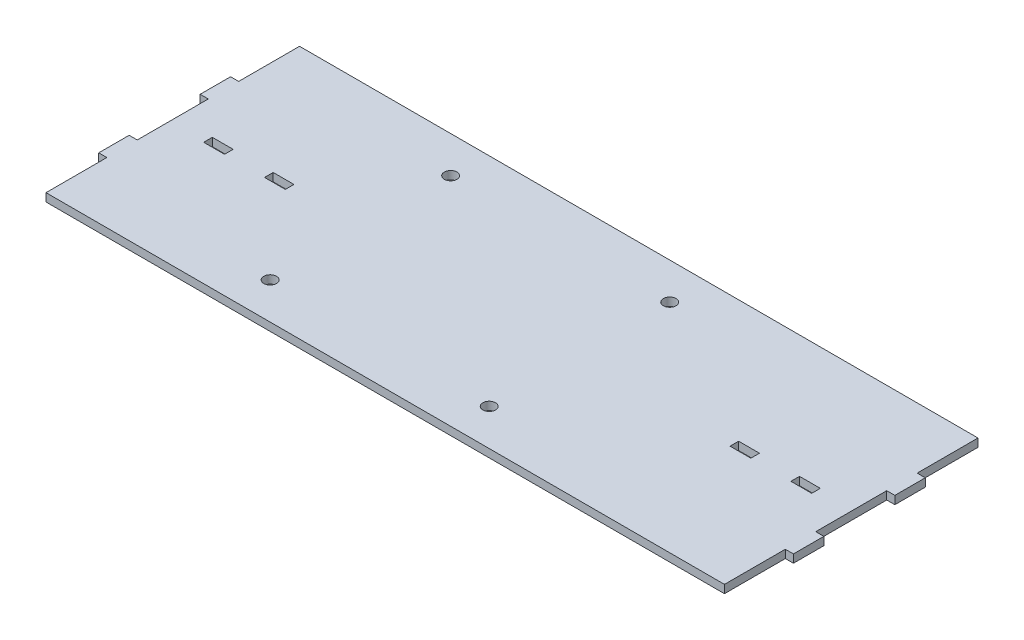
from build123d import *

# Parameters (mm, degrees)
SKETCH1_W                        = 685
SKETCH1_H                        = 250
BASE_FLANGE1_DEPTH               = 8
SKETCH6_W                        = 60
SKETCH6_H                        = 8
SKETCH6_W_2                      = 70
EXTRUDE1_DEPTH                   = 8
SKETCH7_W                        = 250
SKETCH7_H                        = 73.5
BASE_FLANGE2_DEPTH               = 8
SKETCH12_W                       = 30.5
SKETCH12_H                       = 8.5
EXTRUDE2_DEPTH                   = 699.681794525
SKETCH14_W                       = 250
SKETCH14_H                       = 8
BASE_FLANGE3_DEPTH               = 50.5
SKETCH19_W                       = 60
SKETCH19_H                       = 8
SKETCH19_W_2                     = 70
EXTRUDE3_DEPTH                   = 8
BREAK_CORNER1_START              = 41.5
BREAK_CORNER1_DEPTH              = 8
EXTRUDE4_DEPTH                   = 8
BASE_FLANGE4_DEPTH               = 8
SKETCH38_W                       = 8.5
SKETCH38_H                       = 20.5
EXTRUDE5_DEPTH                   = 10
SKETCH39_W                       = 20.5
SKETCH39_H                       = 8.5
EXTRUDE6_DEPTH                   = 10
F_12_5_12_5_DIAMETER_HOLE1_D     = 12.5
F_12_5_12_5_DIAMETER_HOLE1_DEPTH = 10
F_12_5_12_5_DIAMETER_HOLE1_TIP   = 3.755378869


# Read off the part's stored shape, not the designer's step: Break-Corner1
# Sheet-metal steps are written as plain solids
with BuildPart() as part:
    # Sketch1 → Base-Flange1 (new body)
    with BuildSketch(Plane(origin=(0, 0, 0), x_dir=(1, 0, 0), z_dir=(0, 1, 0))):
        Rectangle(SKETCH1_W, SKETCH1_H)
    extrude(amount=-BASE_FLANGE1_DEPTH)

    # Sketch6 → Extrude1 (cut)
    with BuildSketch(Plane(origin=(342.5, 0, 0), x_dir=(0, 0, -1), z_dir=(1, 0, 0))):
        with Locations((-95, -4)):
            Rectangle(SKETCH6_W, SKETCH6_H)
        with Locations((95, -4)):
            Rectangle(SKETCH6_W, SKETCH6_H)
        with Locations((0, -4)):
            Rectangle(SKETCH6_W_2, SKETCH6_H)
    extrude1 = extrude(amount=-EXTRUDE1_DEPTH, mode=Mode.SUBTRACT)

    # Mirror1: Extrude1 across plane
    add(extrude1.mirror(Plane(origin=(0, 0, 0), x_dir=(0, 0, 1), z_dir=(1, 0, 0))), mode=Mode.SUBTRACT)

    # Sketch39 → Extrude6 (cut)
    with BuildSketch(Plane.XZ.offset(8)):
        with Locations((289.5, 0)):
            Rectangle(SKETCH39_W, SKETCH39_H)
        with Locations((229.5, 0)):
            Rectangle(SKETCH39_W, SKETCH39_H)
        with Locations((-289.5, 0)):
            Rectangle(SKETCH39_W, SKETCH39_H)
        with Locations((-229.5, 0)):
            Rectangle(SKETCH39_W, SKETCH39_H)
    extrude(amount=-EXTRUDE6_DEPTH, mode=Mode.SUBTRACT)

    # Ø12.5 (12.5) Diameter Hole1
    with Locations(Plane(origin=(131.975, 0, 2029.150100001), x_dir=(1, 0, 0), z_dir=(0, 1, 0))):
        with Locations((-281.475, 2118.150100001), (-281.475, 1940.150100001), (-65.475, 1940.150100001), (-65.475, 2118.150100001)):
            Hole(F_12_5_12_5_DIAMETER_HOLE1_D / 2, depth=F_12_5_12_5_DIAMETER_HOLE1_DEPTH)
            with Locations((0, 0, -(F_12_5_12_5_DIAMETER_HOLE1_DEPTH + F_12_5_12_5_DIAMETER_HOLE1_TIP / 2))):  # 118° drill point
                Cone(0, F_12_5_12_5_DIAMETER_HOLE1_D / 2, F_12_5_12_5_DIAMETER_HOLE1_TIP, mode=Mode.SUBTRACT)


with BuildPart() as body_2:
    # Sketch7 → Base-Flange2 (new body)
    with BuildSketch(Plane(origin=(334.5, 0, 0), x_dir=(0, 0, -1), z_dir=(1, 0, 0))):
        with Locations((0, 20.75)):
            Rectangle(SKETCH7_W, SKETCH7_H)
    extrude(amount=BASE_FLANGE2_DEPTH)

    # Sketch12 → Extrude2 (cut, through all)
    with BuildSketch(Plane(origin=(342.5, 0, 0), x_dir=(0, 0, -1), z_dir=(1, 0, 0))):
        with Locations((-50, -4)):
            Rectangle(SKETCH12_W, SKETCH12_H)
        with Locations((50, -4)):
            Rectangle(SKETCH12_W, SKETCH12_H)
        with Locations((50, 45.5)):
            Rectangle(SKETCH12_W, SKETCH12_H)
        with Locations((-50, 45.5)):
            Rectangle(SKETCH12_W, SKETCH12_H)
    extrude(amount=-EXTRUDE2_DEPTH, mode=Mode.SUBTRACT)

    # Sketch38 → Extrude5 (cut)
    with BuildSketch(Plane(origin=(342.5, 0, 0), x_dir=(0, 0, -1), z_dir=(1, 0, 0))):
        with Locations((0, 27.5)):
            Rectangle(SKETCH38_W, SKETCH38_H)
    extrude(amount=-EXTRUDE5_DEPTH, mode=Mode.SUBTRACT)


with BuildPart() as body_3:
    # Sketch14 → Base-Flange3 (new body)
    with BuildSketch(Plane.ZY.offset(-334.5)):
        with Locations((0, 45.5)):
            Rectangle(SKETCH14_W, SKETCH14_H)
    extrude(amount=-BASE_FLANGE3_DEPTH)

    # Sketch19 → Extrude3 (cut)
    with BuildSketch(Plane(origin=(342.5, 0, 0), x_dir=(0, 0, -1), z_dir=(1, 0, 0))):
        with Locations((95, 45.5)):
            Rectangle(SKETCH19_W, SKETCH19_H)
        with Locations((0, 45.5)):
            Rectangle(SKETCH19_W_2, SKETCH19_H)
        with Locations((-95, 45.5)):
            Rectangle(SKETCH19_W, SKETCH19_H)
    extrude(amount=-EXTRUDE3_DEPTH, mode=Mode.SUBTRACT)

    # Break-Corner1 outline → Break-Corner1 (cut)
    with BuildSketch(Plane(origin=(0, 0, 0), x_dir=(1, 0, 0), z_dir=(0, 1, 0)).offset(BREAK_CORNER1_START)):
        Polygon((385, -125), (385, -110), (370, -125), align=None)
        Polygon((370, 125), (385, 110), (385, 125), align=None)
    extrude(amount=BREAK_CORNER1_DEPTH, mode=Mode.SUBTRACT)

    # Sketch20 → Extrude4 (cut)
    with BuildSketch(Plane(origin=(0, 49.5, 0), x_dir=(1, 0, 0), z_dir=(0, 1, 0))):
        with BuildLine():
            Line((367, 75), (367, 55))
            ThreePointArc((367, 55), (362.5, 50.5), (358, 55))
            Line((358, 55), (358, 75))
            ThreePointArc((358, 75), (362.5, 79.5), (367, 75))
        make_face()
        with BuildLine():
            Line((367, -75), (367, -55))
            ThreePointArc((367, -55), (362.5, -50.5), (358, -55))
            Line((358, -55), (358, -75))
            ThreePointArc((358, -75), (362.5, -79.5), (367, -75))
        make_face()
    extrude(amount=-EXTRUDE4_DEPTH, mode=Mode.SUBTRACT)


with BuildPart() as body_4:
    # Mirror4: mirrored copy
    add(body_3.part.mirror(Plane(origin=(0, 0, 0), x_dir=(0, 0, 1), z_dir=(1, 0, 0))))


with BuildPart() as body_5:
    # Sketch29 → Base-Flange4 (new body)
    with BuildSketch(Plane.XY.offset(4)):
        Polygon((219.5, 0), (219.5, -8), (239.5, -8), (239.5, 0), (279.5, 0), (279.5, -8), (299.5, -8), (299.5, 0), (334.5, 0), (334.5, 17.5), (342.5, 17.5), (342.5, 37.5), (334.5, 37.5), (334.5, 57.5), (194.5, 10), (194.5, 0), align=None)
    extrude(amount=-BASE_FLANGE4_DEPTH)


with BuildPart() as body_6:
    # Mirror5: mirrored copy
    add(body_5.part.mirror(Plane(origin=(0, 0, 0), x_dir=(0, 0, 1), z_dir=(1, 0, 0))))


with BuildPart() as body_7:
    # Mirror3: mirrored copy
    add(body_2.part.mirror(Plane(origin=(0, 0, 0), x_dir=(0, 0, 1), z_dir=(1, 0, 0))))


solid = part.part
